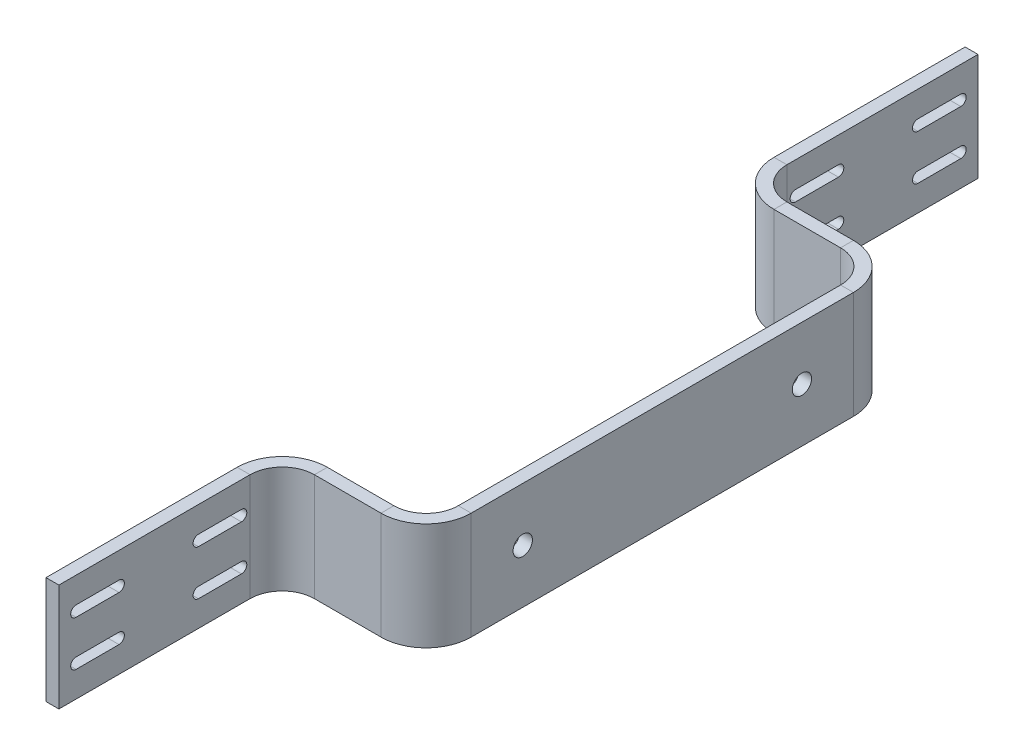
from build123d import *

# Parameters (mm, degrees)
SKETCH1_W                    = 110
SKETCH1_H                    = 50
BASE_FLANGE1_DEPTH           = 6
CUT_EXTRUDE1_DEPTH           = 10
LPATTERN1_COUNT              = 2
LPATTERN1_PITCH              = 57
MIRROR1_COPY_1_DEPTH         = 10
EDGE_FLANGE1_STRIP_W         = 54
EDGE_FLANGE1_STRIP_H         = 6
EDGE_FLANGE1_STRIP_CUT_DEPTH = 50
EDGE_FLANGE1_DEPTH           = 50
EDGE_FLANGE2_STRIP_W         = 54
EDGE_FLANGE2_STRIP_H         = 6
EDGE_FLANGE2_STRIP_CUT_DEPTH = 50
EDGE_FLANGE2_DEPTH           = 50
SKETCH9_R                    = 4.5
CUT_EXTRUDE2_DEPTH           = 10


# Sheet-metal steps are written as plain solids
with BuildPart() as part:
    # Sketch1 → Base-Flange1 (new body)
    with BuildSketch(Plane(origin=(0, 0, 0), x_dir=(0, 0, -1), z_dir=(1, 0, 0))):
        Rectangle(SKETCH1_W, SKETCH1_H)
    extrude(amount=-BASE_FLANGE1_DEPTH)

    # Sketch5 → Cut-Extrude1 (cut)
    with BuildSketch(Plane.ZY.offset(6)):
        with BuildLine():
            Line((-30, 13), (-10, 13))
            ThreePointArc((-10, 13), (-7.5, 10.5), (-10, 8))
            Line((-10, 8), (-30, 8))
            ThreePointArc((-30, 8), (-32.5, 10.5), (-30, 13))
        make_face()
    cut_extrude1 = extrude(amount=-CUT_EXTRUDE1_DEPTH, mode=Mode.SUBTRACT)

    # LPattern1: Cut-Extrude1 ×2
    with Locations(*[(0, 0, i * LPATTERN1_PITCH) for i in range(1, LPATTERN1_COUNT)]):
        add(cut_extrude1, mode=Mode.SUBTRACT)

    # Mirror1: Cut-Extrude1 across plane
    add(cut_extrude1.mirror(Plane.ZX), mode=Mode.SUBTRACT)

    # Mirror1 copy 1 sketch → Mirror1 copy 1 (cut)
    with BuildSketch(Plane(origin=(-6, 0, 57), x_dir=(0, 0, 1), z_dir=(-1, 0, 0))):
        with BuildLine():
            Line((-30, -13), (-10, -13))
            ThreePointArc((-10, -13), (-7.5, -10.5), (-10, -8))
            Line((-10, -8), (-30, -8))
            ThreePointArc((-30, -8), (-32.5, -10.5), (-30, -13))
        make_face()
    extrude(amount=-MIRROR1_COPY_1_DEPTH, mode=Mode.SUBTRACT)

    # Edge-Flange1 strip (across the edge) → Edge-Flange1 strip cut (cut)
    with BuildSketch(Plane(origin=(0, -25, -55), x_dir=(0, 0, 1), z_dir=(0, 1, 0))):
        with Locations((-6, -3)):
            Rectangle(EDGE_FLANGE1_STRIP_W, EDGE_FLANGE1_STRIP_H)
    extrude(amount=EDGE_FLANGE1_STRIP_CUT_DEPTH, mode=Mode.SUBTRACT)

    # Edge-Flange1 section (across the edge) → Edge-Flange1 (add)
    with BuildSketch(Plane(origin=(0, -25, -55), x_dir=(0, 0, 1), z_dir=(0, 1, 0))):
        with BuildLine():
            Line((0, 15), (0, 67))
            Line((0, 67), (6, 67))
            Line((6, 67), (6, 15))
            ThreePointArc((6, 15), (10.393398282, 4.393398282), (21, 0))
            Line((21, 0), (21, -6))
            ThreePointArc((21, -6), (6.150757595, 0.150757595), (0, 15))
        make_face()
    extrude(amount=EDGE_FLANGE1_DEPTH)

    # Edge-Flange2 strip (across the edge) → Edge-Flange2 strip cut (cut)
    with BuildSketch(Plane(origin=(67, 25, -55), x_dir=(-1, 0, 0), z_dir=(0, -1, 0))):
        with Locations((-6, -3)):
            Rectangle(EDGE_FLANGE2_STRIP_W, EDGE_FLANGE2_STRIP_H)
    extrude(amount=EDGE_FLANGE2_STRIP_CUT_DEPTH, mode=Mode.SUBTRACT)

    # Edge-Flange2 section (across the edge) → Edge-Flange2 (add)
    with BuildSketch(Plane(origin=(67, 25, -55), x_dir=(-1, 0, 0), z_dir=(0, -1, 0))):
        with BuildLine():
            Line((0, 15), (0, 104))
            Line((0, 104), (6, 104))
            Line((6, 104), (6, 15))
            ThreePointArc((6, 15), (10.393398282, 4.393398282), (21, 0))
            Line((21, 0), (21, -6))
            ThreePointArc((21, -6), (6.150757595, 0.150757595), (0, 15))
        make_face()
    extrude(amount=EDGE_FLANGE2_DEPTH)

    # Sketch9 → Cut-Extrude2 (cut)
    with BuildSketch(Plane.ZY.offset(-61)):
        with Locations((-94, 0)):
            Circle(SKETCH9_R)
    extrude(amount=-CUT_EXTRUDE2_DEPTH, mode=Mode.SUBTRACT)

    # Mirror2: part across plane


with BuildPart() as part_1:
    add(part.part)
    add(part.part.mirror(Plane(origin=(67, 25, -159), x_dir=(1, 0, 0), z_dir=(0, 0, 1))))


solid = part_1.part
